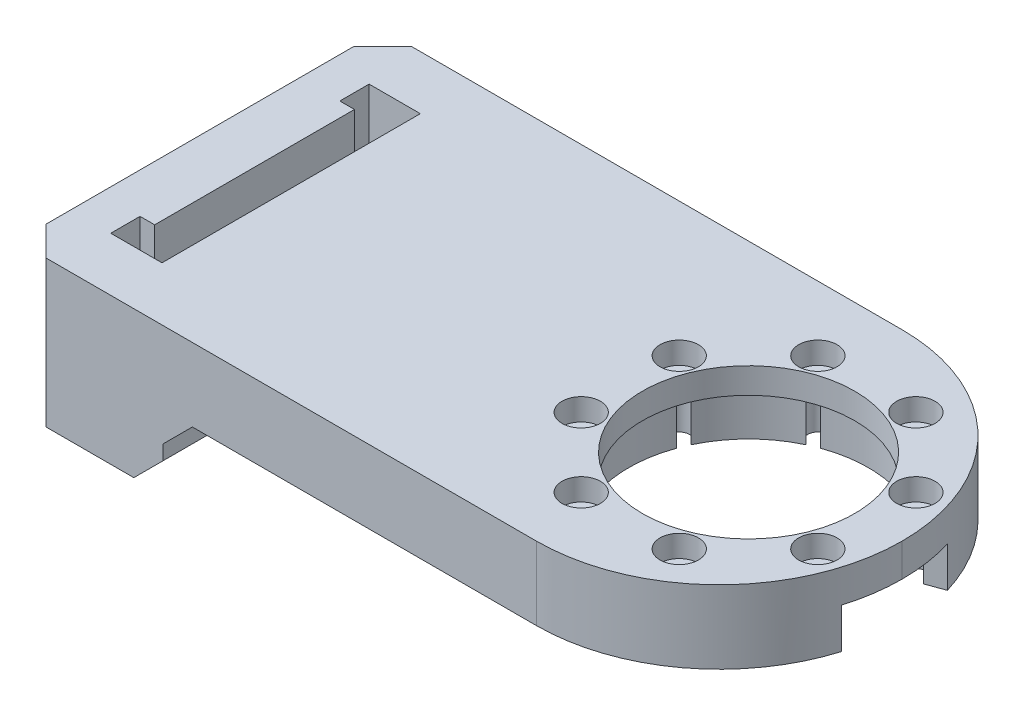
from build123d import *

# Parameters (mm, degrees)
SKETCH1_W                               = 152
SKETCH1_H                               = 100
BOSS_EXTRUDE1_DEPTH                     = 20
BOSS_EXTRUDE2_DEPTH                     = 20
BOSS_EXTRUDE2_DEPTH_BACK                = 20
SKETCH18_W                              = 40
SKETCH18_H                              = 100
SKETCH18_W_2                            = 10
SKETCH18_H_2                            = 70.6
CUT_EXTRUDE3_DEPTH                      = 160.373774505
CUT_EXTRUDE3_DEPTH_BACK                 = 160.373774505
SKETCH19_W                              = 4
SKETCH19_H                              = 8
SKETCH20_R                              = 2.5
CUT_EXTRUDE4_DEPTH                      = 15
CHAMFER1_SIZE                           = 8
CUT_EXTRUDE1_DEPTH                      = 164.095064303
CUT_EXTRUDE1_DEPTH_BACK                 = 164.095064303
SKETCH11_R                              = 29
CUT_EXTRUDE5_DEPTH                      = 11
SKETCH15_R                              = 32.75
CUT_EXTRUDE2_DEPTH                      = 13
CBORE_FOR_M5_HEX_HEAD_BOLT2_D           = 5.5
CBORE_FOR_M5_HEX_HEAD_BOLT2_CBORE_D     = 10.5
CBORE_FOR_M5_HEX_HEAD_BOLT2_CBORE_DEPTH = 6
FILLET1_R                               = 50


with BuildPart() as part:
    # Sketch1 → Boss-Extrude1 (new body)
    with BuildSketch(Plane(origin=(0, 0, 0), x_dir=(1, 0, 0), z_dir=(0, 1, 0))):
        with Locations((-34, 0)):
            Rectangle(SKETCH1_W, SKETCH1_H)
    extrude(amount=BOSS_EXTRUDE1_DEPTH)

    # Sketch18 → Boss-Extrude2 (add, two sides: drawn at the far end of the back side and taken through both)
    with BuildSketch(Plane(origin=(0, 0, 0), x_dir=(1, 0, 0), z_dir=(0, 1, 0)).offset(-BOSS_EXTRUDE2_DEPTH_BACK)):
        with Locations((-130, 0)):
            Rectangle(SKETCH18_W, SKETCH18_H)
        with Locations((-130, 0)):
            Rectangle(SKETCH18_W_2, SKETCH18_H_2, mode=Mode.SUBTRACT)
    extrude(amount=BOSS_EXTRUDE2_DEPTH + BOSS_EXTRUDE2_DEPTH_BACK)

    # Sketch19 → Cut-Extrude3 (cut, two sides: drawn at the far end of the back side and taken through both)
    with BuildSketch(Plane(origin=(0, 0, 0), x_dir=(1, 0, 0), z_dir=(0, 1, 0)).offset(-CUT_EXTRUDE3_DEPTH_BACK)):
        with Locations((-137, -31.3)):
            Rectangle(SKETCH19_W, SKETCH19_H)
        with Locations((-137, 31.3)):
            Rectangle(SKETCH19_W, SKETCH19_H)
    extrude(amount=CUT_EXTRUDE3_DEPTH + CUT_EXTRUDE3_DEPTH_BACK, mode=Mode.SUBTRACT)

    # Sketch20 → Cut-Extrude4 (cut)
    with BuildSketch(Plane.ZY.offset(150)):
        with Locations((-31.3, 0)):
            Circle(SKETCH20_R)
        with Locations((31.3, 0)):
            Circle(SKETCH20_R)
    extrude(amount=-CUT_EXTRUDE4_DEPTH, mode=Mode.SUBTRACT)

    # Chamfer1
    chamfer1_edges = [part.edges().sort_by_distance(p)[0] for p in [
        (-110, -20, 0),
        (-150, 0, 50),
        (-150, 0, -50),
        (-110, 0, 0),
    ]]
    chamfer(chamfer1_edges, length=CHAMFER1_SIZE)

    # Sketch11 → Cut-Extrude1 (cut, two sides: drawn at the far end of the back side and taken through both)
    with BuildSketch(Plane(origin=(0, 20, 0), x_dir=(1, 0, 0), z_dir=(0, 1, 0)).offset(-CUT_EXTRUDE1_DEPTH_BACK)):
        with Locations(Location((0, 0, 0), (0, 0, 90))):
            Circle(SKETCH11_R)
    extrude(amount=CUT_EXTRUDE1_DEPTH + CUT_EXTRUDE1_DEPTH_BACK, mode=Mode.SUBTRACT)

    # Sketch21 → Cut-Extrude5 (cut)
    with BuildSketch(Plane(origin=(0, 0, 0), x_dir=(1, 0, 0), z_dir=(0, 1, 0))):
        Polygon((0, 0), (52.866493453, -19.241830007), (52.866493453, 19.241830007), align=None)
    extrude(amount=CUT_EXTRUDE5_DEPTH, mode=Mode.SUBTRACT)

    # Sketch15 → Cut-Extrude2 (cut)
    with BuildSketch(Plane(origin=(0, 0, 0), x_dir=(1, 0, 0), z_dir=(0, 1, 0))):
        with Locations(Location((0, 0, 0), (0, 0, 20))):
            Circle(SKETCH15_R)
    extrude(amount=CUT_EXTRUDE2_DEPTH, mode=Mode.SUBTRACT)

    # CBORE for M5 Hex Head Bolt2 (through all)
    with Locations(Plane(origin=(-32.335783638, 20, -13.393920133), x_dir=(0, 0, 1), z_dir=(0, 1, 0))):
        with Locations((0, 0), (-18.941863505, 18.941863505), (-18.941863505, 45.729703771), (0, 64.671567276), (26.787840266, 64.671567276), (45.729703771, 45.729703771), (45.729703771, 18.941863505), (26.787840266, 0)):
            CounterBoreHole(CBORE_FOR_M5_HEX_HEAD_BOLT2_D / 2, CBORE_FOR_M5_HEX_HEAD_BOLT2_CBORE_D / 2, CBORE_FOR_M5_HEX_HEAD_BOLT2_CBORE_DEPTH)

    # Fillet1
    fillet1_edges = [part.edges().sort_by_distance(p)[0] for p in [
        (42, 10, -50),
        (42, 10, 50),
    ]]
    fillet(fillet1_edges, radius=FILLET1_R - 0.0001)  # a hair under: the kernel refuses the full size


solid = part.part
